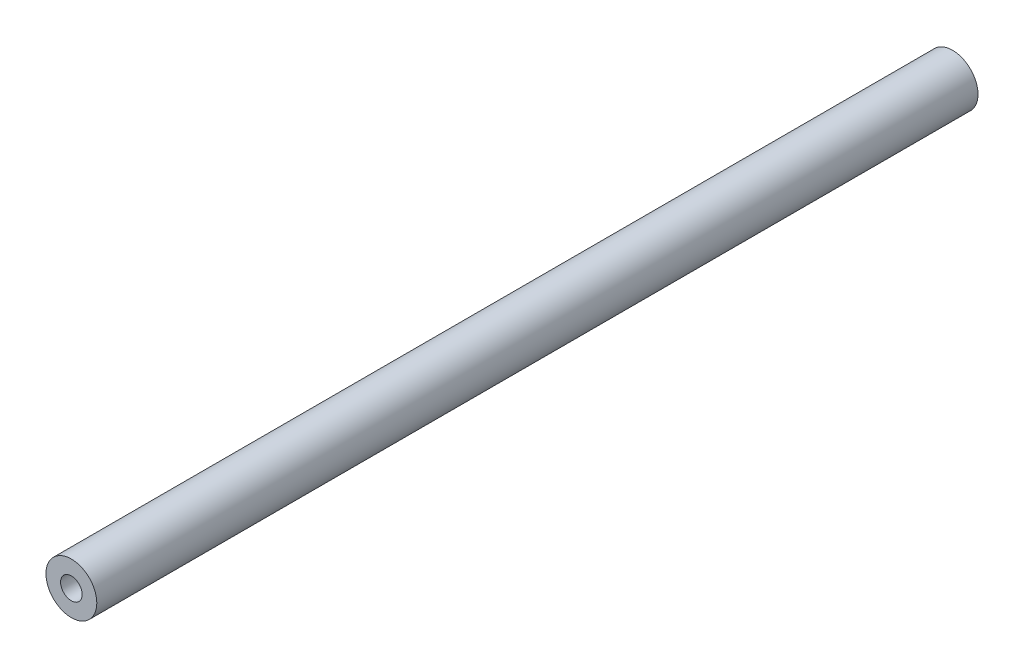
from build123d import *

# Parameters (mm, degrees)
SKETCH1_R                  = 4.7625
BOSS_EXTRUDE1_DEPTH        = 165.1
F_10_32_TAPPED_HOLE1_D     = 4.0386
F_10_32_TAPPED_HOLE1_DEPTH = 19.05
F_10_32_TAPPED_HOLE1_TIP   = 1.213317848
F_10_32_TAPPED_HOLE4_D     = 4.0386
F_10_32_TAPPED_HOLE4_DEPTH = 19.05
F_10_32_TAPPED_HOLE4_TIP   = 1.213317848


with BuildPart() as part:
    # Sketch1 → Boss-Extrude1 (new body)
    with BuildSketch(Plane.XY):
        Circle(SKETCH1_R)
    extrude(amount=-BOSS_EXTRUDE1_DEPTH)

    # #10-32 Tapped Hole1
    with Locations(Plane(origin=(0, 0, -165.1), x_dir=(-1, 0, 0), z_dir=(0, 0, -1))):
        with Locations((0, 0)):
            Hole(F_10_32_TAPPED_HOLE1_D / 2, depth=F_10_32_TAPPED_HOLE1_DEPTH)
            with Locations((0, 0, -(F_10_32_TAPPED_HOLE1_DEPTH + F_10_32_TAPPED_HOLE1_TIP / 2))):  # 118° drill point
                Cone(0, F_10_32_TAPPED_HOLE1_D / 2, F_10_32_TAPPED_HOLE1_TIP, mode=Mode.SUBTRACT)

    # #10-32 Tapped Hole4
    with Locations(Plane.XY):
        with Locations((0, 0)):
            Hole(F_10_32_TAPPED_HOLE4_D / 2, depth=F_10_32_TAPPED_HOLE4_DEPTH)
            with Locations((0, 0, -(F_10_32_TAPPED_HOLE4_DEPTH + F_10_32_TAPPED_HOLE4_TIP / 2))):  # 118° drill point
                Cone(0, F_10_32_TAPPED_HOLE4_D / 2, F_10_32_TAPPED_HOLE4_TIP, mode=Mode.SUBTRACT)


solid = part.part
